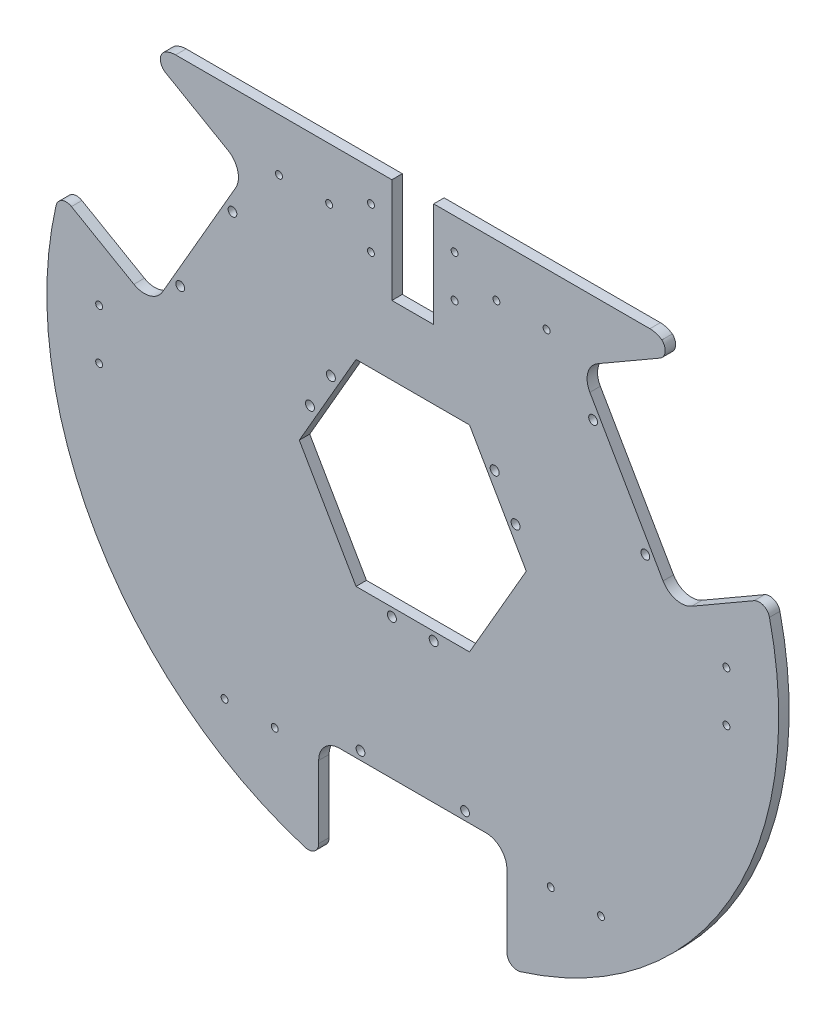
from build123d import *

# Parameters (mm, degrees)
SKETCH_1_R                       = 175
EXTRUDE_1_DEPTH                  = 5
CUT_EXTRUDE_1_DEPTH              = 248.53787589
CUT_EXTRUDE_3_DEPTH              = 248.53787589
M5X0_8_1_D                       = 4.2
HOLE_WIZARD_M4_1_D               = 4.3
FILLET_1_R                       = 10
FILLET_2_R                       = 5
PATTERN_CIRCULAR_1_COUNT         = 3
FILLET_1_OF_PATTERN_CIRCULAR_1_R = 10
FILLET_2_OF_PATTERN_CIRCULAR_1_R = 5
CUT_EXTRUDE_2_DEPTH              = 243.280431899
M4X0_7_1_D                       = 3.3
M4X0_7_2_D                       = 3.3
M4X0_7_3_D                       = 3.3
M4X0_7_4_D                       = 3.3
PATTERN_LINEAR_1_COUNT           = 2
PATTERN_LINEAR_1_PITCH           = 20
SKETCH_30_W                      = 20
SKETCH_30_H                      = 50
CUT_EXTRUDE_4_DEPTH              = 243.280431899
FILLET_3_R                       = 10


with BuildPart() as part:
    # 草圖1 → 填料-伸長1 (new body)
    with BuildSketch(Plane.XY):
        Circle(SKETCH_1_R)
    extrude(amount=EXTRUDE_1_DEPTH)

    # 草圖6 → 除料-伸長1 (cut, through all)
    with BuildSketch(Plane.XY.offset(5)):
        with BuildLine():
            Line((-45, -169.115345253), (-45, -118))
            Line((-45, -118), (45, -118))
            Line((45, -118), (45, -169.115345253))
            ThreePointArc((45, -169.115345253), (0, -175), (-45, -169.115345253))
        make_face()
    cut_extrude_1 = extrude(amount=-CUT_EXTRUDE_1_DEPTH, mode=Mode.SUBTRACT)

    # 草圖12 → 除料-伸長3 (cut, through all)
    with BuildSketch(Plane.XY.offset(5)):
        with BuildLine():
            Line((-117.153745139, 130), (117.153745139, 130))
            ThreePointArc((117.153745139, 130), (0, 175), (-117.153745139, 130))
        make_face()
    extrude(amount=-CUT_EXTRUDE_3_DEPTH, mode=Mode.SUBTRACT)

    # M5x0.8 螺紋孔1 (through all)
    with Locations(Plane.XY.offset(5)):
        with Locations((25, -114), (-25, -114)):
            m5x0_8_1 = Hole(M5X0_8_1_D / 2)

    # M4 餘隙孔1 (through all)
    with Locations(Plane.XY.offset(5)):
        with Locations((10, -51), (-10, -51)):
            hole_wizard_m4_1 = Hole(HOLE_WIZARD_M4_1_D / 2)

    # 圓角1
    fillet_1_edges = [part.edges().sort_by_distance(p)[0] for p in [
        (45, -118, 2.5),
        (-45, -118, 2.5),
    ]]
    fillet(fillet_1_edges, radius=FILLET_1_R)

    # 圓角2
    fillet_2_edges = [part.edges().sort_by_distance(p)[0] for p in [
        (45, -169.115345253, 2.5),
        (-45, -169.115345253, 2.5),
    ]]
    fillet(fillet_2_edges, radius=FILLET_2_R)

    # 環狀複製排列1: 除料-伸長1, M5x0.8 螺紋孔1, M4 餘隙孔1 ×3 about axis
    pattern_circular_1_axis = Axis((0, 0, 0), (0, 0, 1))
    add([cut_extrude_1.rotate(pattern_circular_1_axis, i * 360 / PATTERN_CIRCULAR_1_COUNT) for i in range(1, PATTERN_CIRCULAR_1_COUNT)], mode=Mode.SUBTRACT)
    add([m5x0_8_1.rotate(pattern_circular_1_axis, i * 360 / PATTERN_CIRCULAR_1_COUNT) for i in range(1, PATTERN_CIRCULAR_1_COUNT)], mode=Mode.SUBTRACT)
    add([hole_wizard_m4_1.rotate(pattern_circular_1_axis, i * 360 / PATTERN_CIRCULAR_1_COUNT) for i in range(1, PATTERN_CIRCULAR_1_COUNT)], mode=Mode.SUBTRACT)

    # 圓角1 of 環狀複製排列1
    fillet_1_of_pattern_circular_1_edges = [part.edges().sort_by_distance(p)[0] for p in [
        (79.690997647, 97.97114317, 2.5),
        (124.690997647, 20.02885683, 2.5),
        (-124.690997647, 20.02885683, 2.5),
        (-79.690997647, 97.97114317, 2.5),
    ]]
    fillet(fillet_1_of_pattern_circular_1_edges, radius=FILLET_1_OF_PATTERN_CIRCULAR_1_R)

    # 圓角2 of 環狀複製排列1
    fillet_2_of_pattern_circular_1_edges = [part.edges().sort_by_distance(p)[0] for p in [
        (123.958185159, 123.528815797, 2.5),
        (168.958185159, 45.586529456, 2.5),
        (-168.958185159, 45.586529456, 2.5),
        (-123.958185159, 123.528815797, 2.5),
    ]]
    fillet(fillet_2_of_pattern_circular_1_edges, radius=FILLET_2_OF_PATTERN_CIRCULAR_1_R)

    # 草圖11 → 除料-伸長2 (cut, through all)
    with BuildSketch(Plane.XY.offset(5)):
        Polygon((54.270925304, 0), (27.135462652, 47), (-27.135462652, 47), (-54.270925304, 0), (-27.135462652, -47), (27.135462652, -47), align=None)
    extrude(amount=-CUT_EXTRUDE_2_DEPTH, mode=Mode.SUBTRACT)

    # M4x0.7 螺紋孔1 (through all)
    with Locations(Plane(origin=(0, 0, 0), x_dir=(1, 0, 0), z_dir=(0, 0, -1))):
        with Locations((64, -105), (-40, -105), (40, -105), (-64, -105)):
            Hole(M4X0_7_1_D / 2)

    # M4x0.7 螺紋孔2 (through all)
    with Locations(Plane(origin=(0, 0, 0), x_dir=(-1, 0, 0), z_dir=(0, 0, -1))):
        with Locations((-150, -16), (-150, 8)):
            m4x0_7_2 = Hole(M4X0_7_2_D / 2)

    # 鏡射1: M4x0.7 螺紋孔2 across plane
    add(m4x0_7_2.mirror(Plane(origin=(0, 0, 0), x_dir=(0, 0, 1), z_dir=(1, 0, 0))), mode=Mode.SUBTRACT)

    # M4x0.7 螺紋孔3 (through all)
    with Locations(Plane(origin=(0, 0, 0), x_dir=(-1, 0, 0), z_dir=(0, 0, -1))):
        with Locations((-90, -125), (90, -125), (-66, -125), (66, -125)):
            Hole(M4X0_7_3_D / 2)

    # M4x0.7 螺紋孔4 (through all)
    with Locations(Plane(origin=(0, 0, 0), x_dir=(-1, 0, 0), z_dir=(0, 0, -1))):
        with Locations((-20, 95), (0, 95), (20, 95)):
            m4x0_7_4 = Hole(M4X0_7_4_D / 2)

    # 直線複製排列1: M4x0.7 螺紋孔4 ×2
    with Locations(*[(0, i * PATTERN_LINEAR_1_PITCH, 0) for i in range(1, PATTERN_LINEAR_1_COUNT)]):
        add(m4x0_7_4, mode=Mode.SUBTRACT)

    # 草圖30 → 除料-伸長4 (cut, through all)
    with BuildSketch(Plane(origin=(0, 0, 0), x_dir=(-1, 0, 0), z_dir=(0, 0, -1))):
        with Locations((0, 105)):
            Rectangle(SKETCH_30_W, SKETCH_30_H)
    extrude(amount=-CUT_EXTRUDE_4_DEPTH, mode=Mode.SUBTRACT)

    # 圓角3
    # the kernel refuses this fillet: 10 mm, written as the material it takes off along each edge
    with BuildSketch(Plane(origin=(117.153745139, 130, 14.387351056), x_dir=(-1, 0, 0), z_dir=(0, 0, -1))) as fillet_3_piece_1:
        with BuildLine():
            CenterArc((3.754940422, -10), FILLET_3_R, 90, 34.868690312)
            ThreePointArc((-1.962035679, -1.795355934), (-0.984428411, -0.89395076), (0, 0))
            Line((0, 0), (3.754940422, 0))
        make_face()
    extrude(amount=23.774702112, mode=Mode.SUBTRACT)
    with BuildSketch(Plane(origin=(-117.153745139, 130, 14.387351056), x_dir=(-0.7377488527990645, -0.6750752774273876, 0), z_dir=(0, 0, -1))) as fillet_3_piece_2:
        with BuildLine():
            CenterArc((3.980549785, -9.912355975), FILLET_3_R, 97.591305889, 34.868690312)
            Line((-2.770202989, -2.534867447), (0, 0))
            ThreePointArc((0, 0), (1.329744988, 0.005052135), (2.659489977, 0))
        make_face()
    extrude(amount=23.774702112, mode=Mode.SUBTRACT)


solid = part.part
